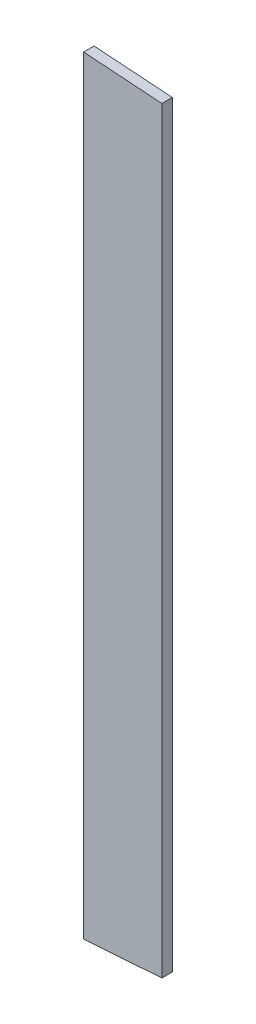
from build123d import *

# Parameters (mm, degrees)
BOSS_EXTRUDE1_DEPTH = 2


with BuildPart() as part:
    # Sketch1 → Boss-Extrude1 (new body)
    with BuildSketch(Plane.XY.offset(2800.649999999)):
        Polygon((-49.769678516, 346.108282384), (-64.769678516, 345.059380205), (-64.769678516, 492.415801833), (-49.769678516, 491.366899654), align=None)
    extrude(amount=BOSS_EXTRUDE1_DEPTH)


solid = part.part
